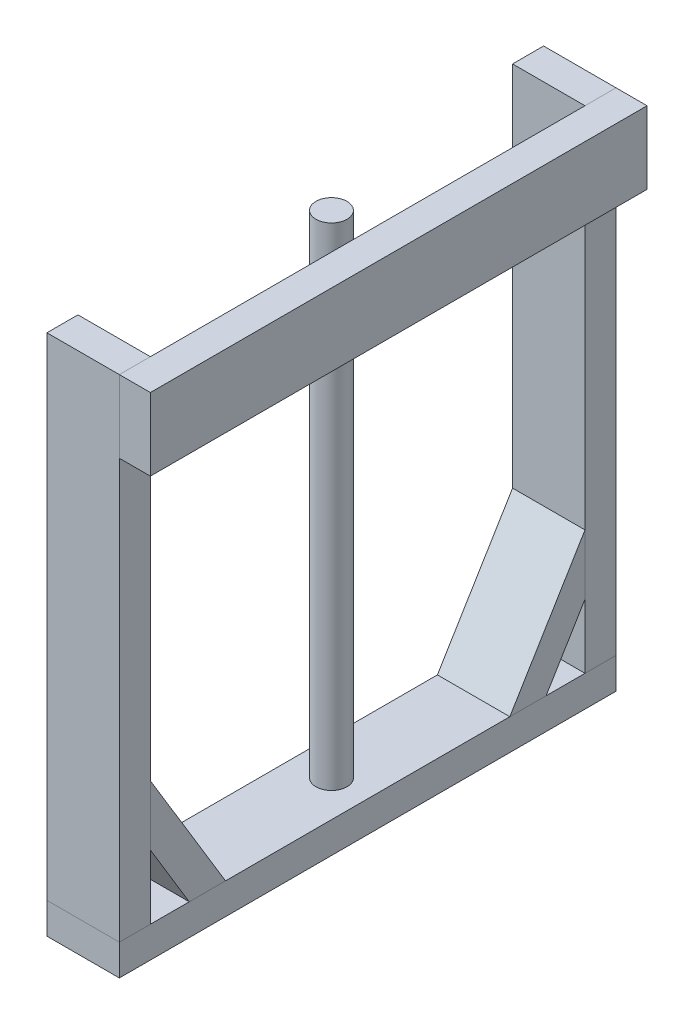
from build123d import *

# Parameters (mm, degrees)
SKETCH1_W                  = 609.6
SKETCH1_H                  = 88.9
TOP_CROSS_SUPPORT_DEPTH    = 38.1
SKETCH2_W                  = 38.1
SKETCH2_H                  = 603.25
LEG_DEPTH                  = 88.9
SKETCH4_W                  = 88.9
SKETCH4_H                  = 609.6
BOTTOM_CROSS_SUPPORT_DEPTH = 38.1
LOW_DIAGONAL_SUPPORT_DEPTH = 88.9
SKETCH6_R                  = 19.05
ACTUATOR_DEPTH             = 603.25


with BuildPart() as part:
    # Sketch1 → Top_Cross_Support (new body)
    with BuildSketch(Plane(origin=(0, 0, 0), x_dir=(0, 0, -1), z_dir=(1, 0, 0))):
        with Locations((0, -44.45)):
            Rectangle(SKETCH1_W, SKETCH1_H)
    extrude(amount=TOP_CROSS_SUPPORT_DEPTH)


with BuildPart() as body_2:
    # Sketch2 → Leg (new body)
    with BuildSketch(Plane.ZY):
        with Locations((285.75, -301.625)):
            Rectangle(SKETCH2_W, SKETCH2_H)
    extrude(amount=LEG_DEPTH)


with BuildPart() as body_3:
    # Leg_Mirror: mirrored copy
    add(body_2.part.mirror(Plane.XY))


with BuildPart() as body_4:
    # Sketch4 → Bottom_Cross_Support (new body)
    with BuildSketch(Plane.XZ.offset(603.25)):
        with Locations((-44.45, 0)):
            Rectangle(SKETCH4_W, SKETCH4_H)
    extrude(amount=BOTTOM_CROSS_SUPPORT_DEPTH)


with BuildPart() as body_5:
    # Sketch5 → Low_Diagonal_Support (new body)
    with BuildSketch(Plane(origin=(0, 0, 0), x_dir=(0, 0, -1), z_dir=(1, 0, 0))):
        Polygon((-218.981536726, -603.25), (-266.7, -524.422298286), (-266.7, -450.85), (-174.444439521, -603.25), align=None)
    extrude(amount=-LOW_DIAGONAL_SUPPORT_DEPTH)


with BuildPart() as body_6:
    # Low_Diagonal_Support_Mirror: mirrored copy
    add(body_5.part.mirror(Plane.XY))


with BuildPart() as body_7:
    # Sketch6 → Actuator (new body)
    with BuildSketch(Plane(origin=(0, -603.25, 0), x_dir=(1, 0, 0), z_dir=(0, 1, 0))):
        with Locations((-44.45, 0)):
            Circle(SKETCH6_R)
    extrude(amount=ACTUATOR_DEPTH)


solid = Compound([part.part, body_2.part, body_3.part, body_4.part, body_5.part, body_6.part, body_7.part])
